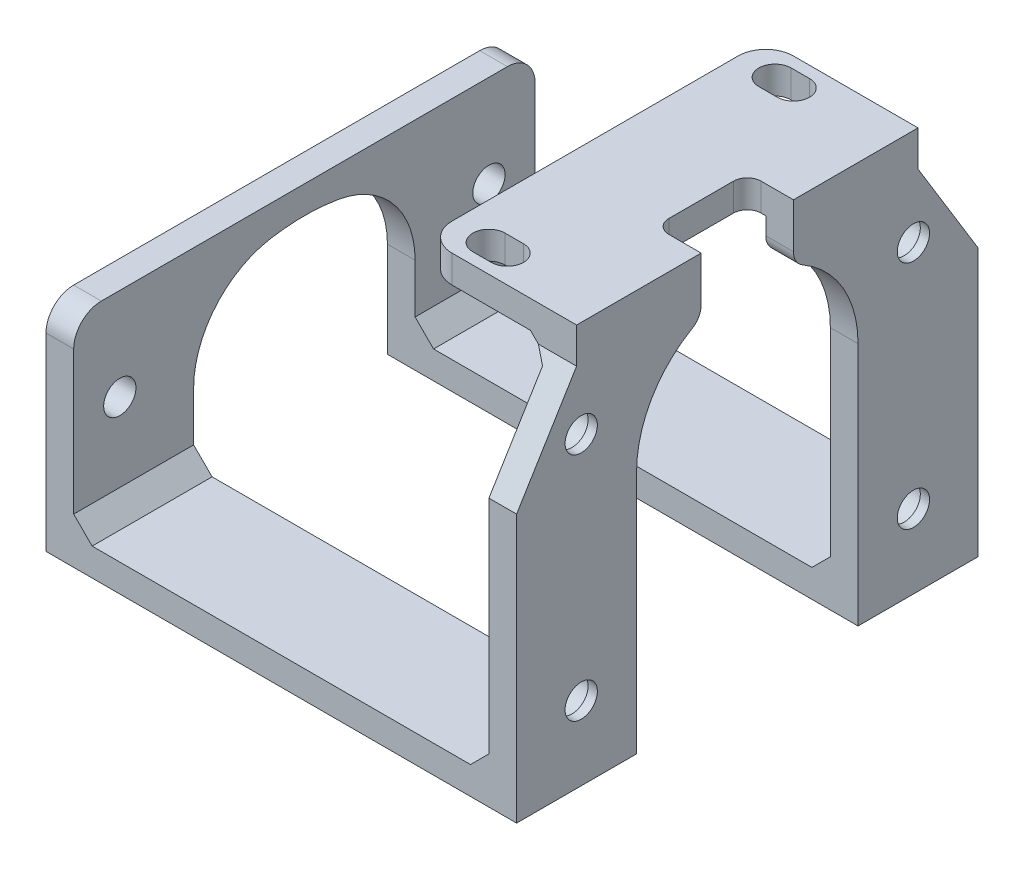
from build123d import *

# Parameters (mm, degrees)
EXTRUDE_THIN1_DEPTH = 25
SKETCH2_R           = 1.75
CUT_EXTRUDE1_DEPTH  = 3
CUT_EXTRUDE2_REACH  = 63.467
CUT_EXTRUDE3_REACH  = 63.467
CUT_EXTRUDE4_DEPTH  = 3
CUT_EXTRUDE5_REACH  = 72.48
SKETCH7_R           = 1.75
FILLET1_R           = 3
CUT_EXTRUDE7_REACH  = 63.467
SKETCH9_R           = 1.75
CUT_EXTRUDE8_START  = -3
CUT_EXTRUDE8_DEPTH  = 3
SKETCH11_R          = 2.1
CUT_EXTRUDE10_DEPTH = 2
CUT_EXTRUDE11_DEPTH = 10
CHAMFER1_SIZE       = 2
FILLET2_R           = 2


with BuildPart() as part:
    # Sketch1 → Extrude-Thin1 (new, symmetric)
    with BuildSketch(Plane.XY):
        Polygon((-1.5, 0), (-1.5, -23.5), (49.5, -23.5), (49.5, 20), (33, 20), (33, 17), (46.5, 17), (46.5, -20.5), (1.5, -20.5), (1.5, 0), align=None)
    extrude(amount=EXTRUDE_THIN1_DEPTH, both=True)

    # Sketch2 → Cut-Extrude1 (cut)
    with BuildSketch(Plane.ZY.offset(1.5)):
        with Locations(Location((-20, -10, 0), (0, 0, 270))):
            Circle(SKETCH2_R)
        with Locations(Location((20, -10, 0), (0, 0, 270))):
            Circle(SKETCH2_R)
    extrude(amount=-CUT_EXTRUDE1_DEPTH, mode=Mode.SUBTRACT)

    # Cut-Extrude2: up to this face of the body (flat: up to its plane)
    cut_extrude2_end = Plane(part.part.faces().sort_by_distance((46.5, -1.75, 0))[0])
    # Sketch3 → Cut-Extrude2 (cut, up to the picked face)
    with BuildSketch(Plane.ZY.offset(1.5), mode=Mode.PRIVATE) as cut_extrude2_sk1:
        with BuildLine():
            Line((-12, -13.167840434), (-12, -27.818696))
            Line((-12, -27.818696), (12, -27.818696))
            Line((12, -27.818696), (12, -13.167840434))
            ThreePointArc((12, -13.167840434), (9.637626158, -6.71286819), (3.666666667, -3.307707462))
            ThreePointArc((3.666666667, -3.307707462), (0, -3), (-3.666666667, -3.307707462))
            ThreePointArc((-3.666666667, -3.307707462), (-9.637626158, -6.71286819), (-12, -13.167840434))
        make_face()
    cut_extrude2_tool1 = split(extrude(cut_extrude2_sk1.sketch, amount=-CUT_EXTRUDE2_REACH, mode=Mode.PRIVATE), bisect_by=cut_extrude2_end, keep=Keep.BOTH, mode=Mode.PRIVATE)
    add(cut_extrude2_tool1.solids().sort_by(Axis((-1.5, -16.267413, 0), (1, 0, 0)))[0], mode=Mode.SUBTRACT)

    # Sketch5 → Cut-Extrude3 (cut, up to next)
    with BuildSketch(Plane(origin=(49.5, 0, 0), x_dir=(0, 0, -1), z_dir=(1, 0, 0)), mode=Mode.PRIVATE) as cut_extrude3_sk1:
        Polygon((-18.5, 20), (-18.5, 16.133851182), (-25, 5.502473915), (-25, 20), align=None)
    cut_extrude3_tool1 = extrude(cut_extrude3_sk1.sketch, amount=-CUT_EXTRUDE3_REACH, mode=Mode.PRIVATE) & part.part
    cut_extrude3 = cut_extrude3_tool1.solids().sort_by_distance((49.5, 14.896175, 22.37718))[0]
    add(cut_extrude3, mode=Mode.SUBTRACT)

    # Mirror1: Cut-Extrude3 across plane
    add(cut_extrude3.mirror(Plane.XY), mode=Mode.SUBTRACT)

    # Sketch6 → Cut-Extrude4 (cut)
    with BuildSketch(Plane(origin=(49.5, 0, 0), x_dir=(0, 0, -1), z_dir=(1, 0, 0))):
        with BuildLine():
            Line((-12, -23.5), (12, -23.5))
            Line((12, -23.5), (12, 3))
            ThreePointArc((12, 3), (0, 15), (-12, 3))
            Line((-12, 3), (-12, -23.5))
        make_face()
    extrude(amount=-CUT_EXTRUDE4_DEPTH, mode=Mode.SUBTRACT)

    # Sketch7 → Cut-Extrude5 (cut, up to next)
    with BuildSketch(Plane(origin=(0, 20, 0), x_dir=(1, 0, 0), z_dir=(0, 1, 0)), mode=Mode.PRIVATE) as cut_extrude5_sk1:
        with Locations(Location((38, 15.5, 0), (0, 0, 180))):
            Circle(SKETCH7_R)
    cut_extrude5_tool1 = extrude(cut_extrude5_sk1.sketch, amount=-CUT_EXTRUDE5_REACH, mode=Mode.PRIVATE) & part.part
    # Sketch7 → Cut-Extrude5 (cut, up to next)
    with BuildSketch(Plane(origin=(0, 20, 0), x_dir=(1, 0, 0), z_dir=(0, 1, 0)), mode=Mode.PRIVATE) as cut_extrude5_sk2:
        with Locations(Location((38, -15.5, 0), (0, 0, 180))):
            Circle(SKETCH7_R)
    cut_extrude5_tool2 = extrude(cut_extrude5_sk2.sketch, amount=-CUT_EXTRUDE5_REACH, mode=Mode.PRIVATE) & part.part
    add(cut_extrude5_tool1.solids().sort_by_distance((38, 20, -15.5))[0], mode=Mode.SUBTRACT)
    add(cut_extrude5_tool2.solids().sort_by_distance((38, 20, 15.5))[0], mode=Mode.SUBTRACT)

    # Fillet1
    fillet1_edges = [part.edges().sort_by_distance(p)[0] for p in [
        (0, 0, 25),
        (33, 18.5, 18.5),
        (0, 0, -25),
        (33, 18.5, -18.5),
    ]]
    fillet(fillet1_edges, radius=FILLET1_R)

    # Sketch9 → Cut-Extrude7 (cut, up to next)
    with BuildSketch(Plane(origin=(49.5, 0, 0), x_dir=(0, 0, -1), z_dir=(1, 0, 0)), mode=Mode.PRIVATE) as cut_extrude7_sk1:
        with Locations((-18, -15.5)):
            Circle(SKETCH9_R)
    cut_extrude7_tool1 = extrude(cut_extrude7_sk1.sketch, amount=-CUT_EXTRUDE7_REACH, mode=Mode.PRIVATE) & part.part
    # Sketch9 → Cut-Extrude7 (cut, up to next)
    with BuildSketch(Plane(origin=(49.5, 0, 0), x_dir=(0, 0, -1), z_dir=(1, 0, 0)), mode=Mode.PRIVATE) as cut_extrude7_sk2:
        with Locations((18, -15.5)):
            Circle(SKETCH9_R)
    cut_extrude7_tool2 = extrude(cut_extrude7_sk2.sketch, amount=-CUT_EXTRUDE7_REACH, mode=Mode.PRIVATE) & part.part
    # Sketch9 → Cut-Extrude7 (cut, up to next)
    with BuildSketch(Plane(origin=(49.5, 0, 0), x_dir=(0, 0, -1), z_dir=(1, 0, 0)), mode=Mode.PRIVATE) as cut_extrude7_sk3:
        with Locations((-18, 9.5)):
            Circle(SKETCH9_R)
    cut_extrude7_tool3 = extrude(cut_extrude7_sk3.sketch, amount=-CUT_EXTRUDE7_REACH, mode=Mode.PRIVATE) & part.part
    # Sketch9 → Cut-Extrude7 (cut, up to next)
    with BuildSketch(Plane(origin=(49.5, 0, 0), x_dir=(0, 0, -1), z_dir=(1, 0, 0)), mode=Mode.PRIVATE) as cut_extrude7_sk4:
        with Locations((18, 9.5)):
            Circle(SKETCH9_R)
    cut_extrude7_tool4 = extrude(cut_extrude7_sk4.sketch, amount=-CUT_EXTRUDE7_REACH, mode=Mode.PRIVATE) & part.part
    add(cut_extrude7_tool1.solids().sort_by_distance((49.5, -15.5, 18))[0], mode=Mode.SUBTRACT)
    add(cut_extrude7_tool2.solids().sort_by_distance((49.5, -15.5, -18))[0], mode=Mode.SUBTRACT)
    add(cut_extrude7_tool3.solids().sort_by_distance((49.5, 9.5, 18))[0], mode=Mode.SUBTRACT)
    add(cut_extrude7_tool4.solids().sort_by_distance((49.5, 9.5, -18))[0], mode=Mode.SUBTRACT)

    # Sketch10 → Cut-Extrude8 (cut)
    with BuildSketch(Plane(origin=(0, 20, 0), x_dir=(1, 0, 0), z_dir=(0, 1, 0)).offset(CUT_EXTRUDE8_START)):
        with BuildLine():
            Line((37, 17.25), (39, 17.25))
            ThreePointArc((39, 17.25), (40.75, 15.5), (39, 13.75))
            Line((39, 13.75), (37, 13.75))
            ThreePointArc((37, 13.75), (35.25, 15.5), (37, 17.25))
        make_face()
        with BuildLine():
            Line((37, -13.75), (39, -13.75))
            ThreePointArc((39, -13.75), (40.75, -15.5), (39, -17.25))
            Line((39, -17.25), (37, -17.25))
            ThreePointArc((37, -17.25), (35.25, -15.5), (37, -13.75))
        make_face()
    extrude(amount=CUT_EXTRUDE8_DEPTH, mode=Mode.SUBTRACT)

    # Sketch11 → Cut-Extrude10 (cut)
    with BuildSketch(Plane.ZY.offset(-46.5)):
        with Locations((-18, 9.5)):
            Circle(SKETCH11_R)
        with Locations((18, 9.5)):
            Circle(SKETCH11_R)
        with Locations((18, -15.5)):
            Circle(SKETCH11_R)
        with Locations((-18, -15.5)):
            Circle(SKETCH11_R)
    extrude(amount=-CUT_EXTRUDE10_DEPTH, mode=Mode.SUBTRACT)

    # Sketch12 → Cut-Extrude11 (cut)
    with BuildSketch(Plane(origin=(0, 20, 0), x_dir=(1, 0, 0), z_dir=(0, 1, 0))):
        with BuildLine():
            Line((49.5, -5), (46, -5))
            ThreePointArc((46, -5), (44.939339828, -4.560660172), (44.5, -3.5))
            Line((44.5, -3.5), (44.5, 3.5))
            ThreePointArc((44.5, 3.5), (44.939339828, 4.560660172), (46, 5))
            Line((46, 5), (49.5, 5))
            Line((49.5, 5), (49.5, -5))
        make_face()
    extrude(amount=-CUT_EXTRUDE11_DEPTH, mode=Mode.SUBTRACT)

    # Chamfer1
    chamfer1_edges = [part.edges().sort_by_distance(p)[0] for p in [
        (46.5, 17, 11.75),
        (1.5, -20.5, -18.5),
        (1.5, -20.5, 18.5),
        (46.5, -20.5, 18.5),
        (46.5, -20.5, -18.5),
    ]]
    chamfer(chamfer1_edges, length=CHAMFER1_SIZE - 0.0001)  # a hair under: the kernel refuses the full size

    # Fillet2
    fillet2_edges = [part.edges().sort_by_distance(p)[0] for p in [
        (48, 13.908712115, -5),
        (48, 13.908712115, 5),
    ]]
    fillet(fillet2_edges, radius=FILLET2_R)


solid = part.part
